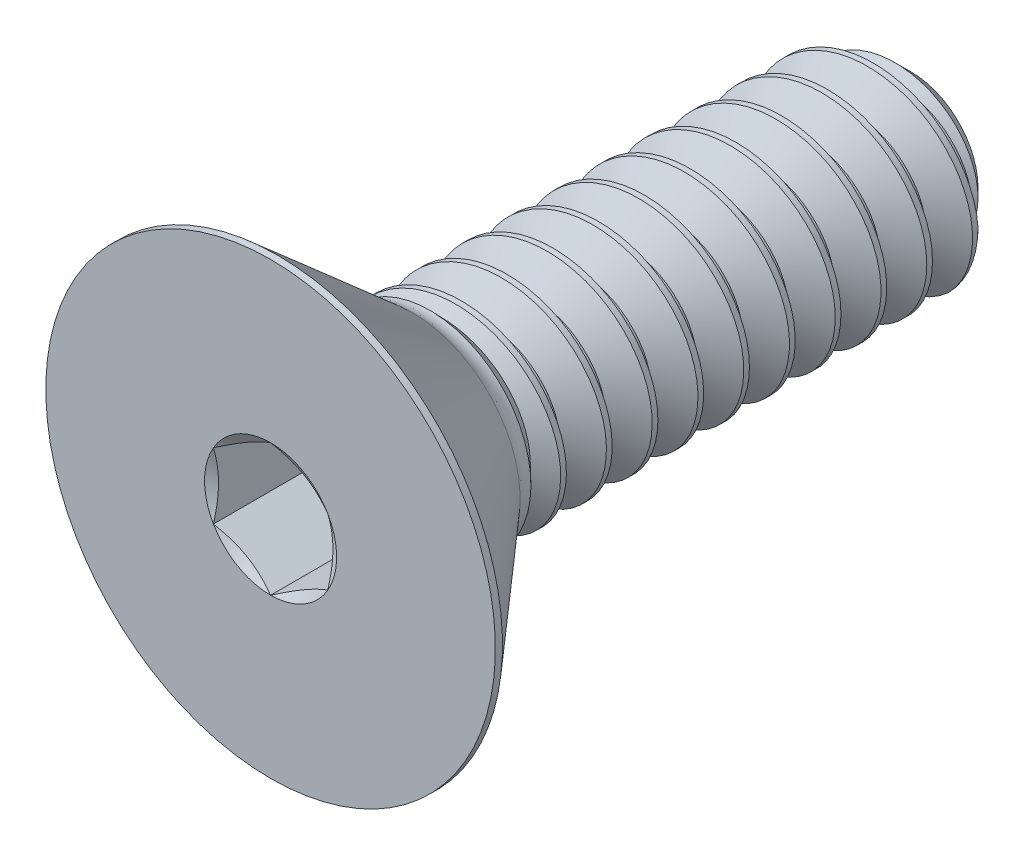
from build123d import *

# Parameters (mm, degrees)
SKETCH1_W          = 11.1125
SKETCH1_H          = 1.7526
CHAMFER1_SIZE      = 0.5953125
CUT_SWEEP1_PITCH   = 0.79375
CUT_EXTRUDE2_DEPTH = 1.72466


with BuildPart() as part:
    # Sketch1 → Revolve1 (revolve)
    with BuildSketch(Plane(origin=(0, 0, 0), x_dir=(0, 0, -1), z_dir=(1, 0, 0)), mode=Mode.PRIVATE) as revolve1_sk:
        with Locations((5.55625, 0.8763)):
            Rectangle(SKETCH1_W, SKETCH1_H)
    revolve(revolve1_sk.sketch.rotate(Axis((0, 0, -11.1125), (0, 0, 1)), 90), axis=Axis((0, 0, -11.1125), (0, 0, 1)))

    # Chamfer1
    chamfer1_edges = [part.edges().sort_by_distance(p)[0] for p in [
        (1.7526, 0, -11.1125),
    ]]
    chamfer(chamfer1_edges, length=CHAMFER1_SIZE)

    # Cut-Sweep1: arcs per turn and ends read off the stored shape
    # Cut-Sweep1: the profile of Sketch2 profile screwed along a right-hand helix through 15 turns, 8 arcs to a turn; built about Z, then put on its axis
    cut_sweep1_z = Axis((0, 0, 0), (0, 0, 1))
    cut_sweep1_corners = [(1.7532, 0, 0.00034641), (1.7532, 0, -0.69487766), (1.237044252, 0, -0.396875), (1.237044252, 0, -0.29765625)]
    with BuildLine(mode=Mode.PRIVATE) as cut_sweep1_profile:
        Line(cut_sweep1_corners[0], cut_sweep1_corners[1])
        Line(cut_sweep1_corners[1], cut_sweep1_corners[2])
        Line(cut_sweep1_corners[2], cut_sweep1_corners[3])
        Line(cut_sweep1_corners[3], cut_sweep1_corners[0])
    cut_sweep1_cap = Face(cut_sweep1_profile.wire())
    cut_sweep1_turn_angles = [0, 22.5, 45, 67.5, 90, 112.5, 135, 157.5, 180, 202.5, 225, 247.5, 270, 292.5, 315, 337.5, 360]
    cut_sweep1_turn_weights = [1, 0.9238795325112867, 1, 0.9238795325112867, 1, 0.9238795325112867, 1, 0.9238795325112867, 1, 0.9238795325112867, 1, 0.9238795325112867, 1, 0.9238795325112867, 1, 0.9238795325112867, 1]
    cut_sweep1_turn_rails = [Edge.make_bspline([Vector(p[0], p[1], 0).rotate(cut_sweep1_z, cut_sweep1_turn_angles[k]) / cut_sweep1_turn_weights[k] + Vector(0, 0, p[2] + CUT_SWEEP1_PITCH * cut_sweep1_turn_angles[k] / 360) for k in range(17)], [0, 0, 0, 1, 1, 2, 2, 3, 3, 4, 4, 5, 5, 6, 6, 7, 7, 8, 8, 8], 2, cut_sweep1_turn_weights) for p in cut_sweep1_corners]
    cut_sweep1_turn_sides = [Face.make_surface_from_curves(cut_sweep1_turn_rails[p[0]], cut_sweep1_turn_rails[p[1]]) for p in [(0, 1), (1, 2), (2, 3), (3, 0)]]
    cut_sweep1 = Plane(origin=(0, 0, -11.1125), x_dir=(0, 1, 0), z_dir=(0, 0, 1)) * Solid(Shell([*[p.moved(Location((0, 0, CUT_SWEEP1_PITCH * i))) for i in range(15) for p in cut_sweep1_turn_sides], cut_sweep1_cap, cut_sweep1_cap.rotate(cut_sweep1_z, 5400).moved(Location((0, 0, CUT_SWEEP1_PITCH * 5400 / 360)))]))
    add(cut_sweep1, mode=Mode.SUBTRACT)

    # Sketch7 → Revolve2 (revolve)
    with BuildSketch(Plane(origin=(0, 0, 0), x_dir=(0, 0, -1), z_dir=(1, 0, 0)), mode=Mode.PRIVATE) as revolve2_sk:
        with BuildLine():
            Line((0, 3.8989), (0.12319, 3.8989))
            Line((0.12319, 3.8989), (2.4638, 1.864238769))
            ThreePointArc((2.4638, 1.864238769), (2.603001936, 1.781422319), (2.76239145, 1.7526))
            Line((2.76239145, 1.7526), (2.76239145, 0))
            Line((2.76239145, 0), (0, 0))
            Line((0, 0), (0, 3.8989))
        make_face()
    revolve(revolve2_sk.sketch.rotate(Axis((0, 0, 0), (0, 0, -1)), 180), axis=Axis((0, 0, 0), (0, 0, -1)))

    # Boss-Extrude1 cone 1 section (through the dimple's axis) → Boss-Extrude1 (revolve)
    with BuildSketch(Plane(origin=(0, 0, -2.76239145), x_dir=(0, -1, 0), z_dir=(1, 0, 0))):
        Polygon((0, 0), (1.7526, 0), (0, 1.692466147), align=None)
    revolve(axis=Axis((0, 0, -2.76239145), (0, 0, -1)))

    # Sketch5 → Cut-Extrude2 (cut)
    with BuildSketch(Plane.XY):
        Polygon((0, 1.14567944), (-0.9921875, 0.57283972), (-0.9921875, -0.57283972), (0, -1.14567944), (0.9921875, -0.57283972), (0.9921875, 0.57283972), align=None)
    extrude(amount=-CUT_EXTRUDE2_DEPTH, mode=Mode.SUBTRACT)

    # Cut-Extrude3 cone 1 section (through the dimple's axis) → Cut-Extrude3 (revolve, cut)
    with BuildSketch(Plane(origin=(0, 0, 0), x_dir=(0, -1, 0), z_dir=(1, 0, 0))):
        Polygon((0, 0), (1.14567944, 0), (0, 0.661458333), align=None)
    revolve(axis=Axis((0, 0, 0), (0, 0, -1)), mode=Mode.SUBTRACT)


solid = part.part
